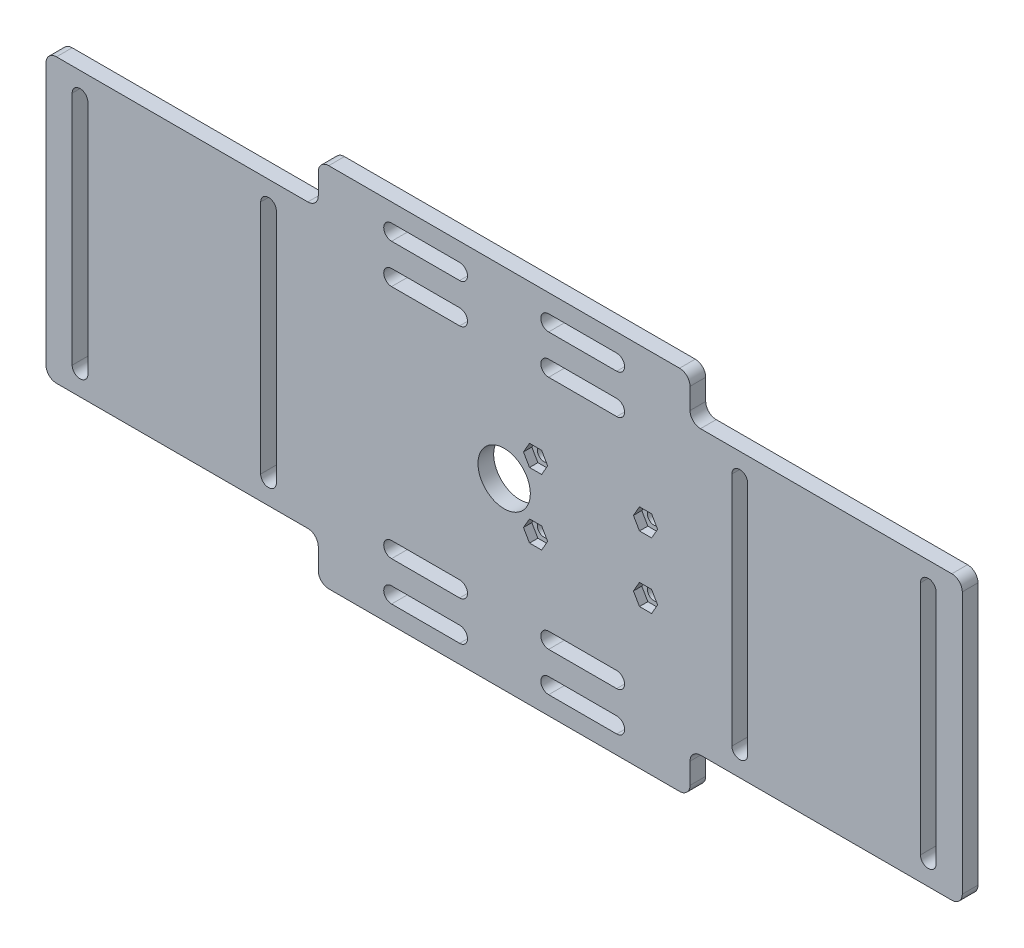
from build123d import *
from OCP.BRepFilletAPI import BRepFilletAPI_MakeChamfer
from build123d.topology import SkipClean

# Parameters (mm, degrees)
EXTRUDE_1_DEPTH     = 3
SKETCH_2_R          = 5
SKETCH_2_R_2        = 1.25
CUT_EXTRUDE_1_DEPTH = 95.288122264
CUT_EXTRUDE_2_DEPTH = 1.6
SKETCH_4_R          = 2
SKETCH_4_R_2        = 1.25
EXTRUDE_2_DEPTH     = 2
CHAMFER_1_SIZE      = 0.5
CHAMFER_1_SIZE2     = 0.288675135


with BuildPart() as part:
    # 草圖1 → 填料-伸長1 (new body)
    with BuildSketch(Plane.XY):
        with BuildLine():
            Line((35.5, 33), (35.5, 29))
            ThreePointArc((35.5, 29), (36.085786438, 27.585786438), (37.5, 27))
            Line((37.5, 27), (85.5, 27))
            ThreePointArc((85.5, 27), (86.914213562, 26.414213562), (87.5, 25))
            Line((87.5, 25), (87.5, -25))
            ThreePointArc((87.5, -25), (86.914213562, -26.414213562), (85.5, -27))
            Line((85.5, -27), (37.5, -27))
            ThreePointArc((37.5, -27), (36.085786438, -27.585786438), (35.5, -29))
            Line((35.5, -29), (35.5, -33))
            ThreePointArc((35.5, -33), (34.914213562, -34.414213562), (33.5, -35))
            Line((33.5, -35), (-33.5, -35))
            ThreePointArc((-33.5, -35), (-34.914213562, -34.414213562), (-35.5, -33))
            Line((-35.5, -33), (-35.5, -29))
            ThreePointArc((-35.5, -29), (-36.085786438, -27.585786438), (-37.5, -27))
            Line((-37.5, -27), (-85.5, -27))
            ThreePointArc((-85.5, -27), (-86.914213562, -26.414213562), (-87.5, -25))
            Line((-87.5, -25), (-87.5, 25))
            ThreePointArc((-87.5, 25), (-86.914213562, 26.414213562), (-85.5, 27))
            Line((-85.5, 27), (-37.5, 27))
            ThreePointArc((-37.5, 27), (-36.085786438, 27.585786438), (-35.5, 29))
            Line((-35.5, 29), (-35.5, 33))
            ThreePointArc((-35.5, 33), (-34.914213562, 34.414213562), (-33.5, 35))
            Line((-33.5, 35), (33.5, 35))
            ThreePointArc((33.5, 35), (34.914213562, 34.414213562), (35.5, 33))
        make_face()
    extrude(amount=EXTRUDE_1_DEPTH)

    # 草圖2 → 除料-伸長1 (cut, through all)
    with BuildSketch(Plane.XY.offset(3)):
        Circle(SKETCH_2_R)
        with Locations((27, 6.25)):
            Circle(SKETCH_2_R_2)
        with Locations((6, 6.25)):
            Circle(SKETCH_2_R_2)
        with Locations((6, -6.25)):
            Circle(SKETCH_2_R_2)
        with Locations((27, -6.25)):
            Circle(SKETCH_2_R_2)
        with BuildLine():
            Line((43.5, -22.5), (43.5, 22.5))
            ThreePointArc((43.5, 22.5), (45, 24), (46.5, 22.5))
            Line((46.5, 22.5), (46.5, -22.5))
            ThreePointArc((46.5, -22.5), (45, -24), (43.5, -22.5))
        make_face()
        with BuildLine():
            Line((-46.5, -22.5), (-46.5, 22.5))
            ThreePointArc((-46.5, 22.5), (-45, 24), (-43.5, 22.5))
            Line((-43.5, 22.5), (-43.5, -22.5))
            ThreePointArc((-43.5, -22.5), (-45, -24), (-46.5, -22.5))
        make_face()
        with BuildLine():
            Line((-82.5, -22.5), (-82.5, 22.5))
            ThreePointArc((-82.5, 22.5), (-81, 24), (-79.5, 22.5))
            Line((-79.5, 22.5), (-79.5, -22.5))
            ThreePointArc((-79.5, -22.5), (-81, -24), (-82.5, -22.5))
        make_face()
        with BuildLine():
            Line((79.5, -22.5), (79.5, 22.5))
            ThreePointArc((79.5, 22.5), (81, 24), (82.5, 22.5))
            Line((82.5, 22.5), (82.5, -22.5))
            ThreePointArc((82.5, -22.5), (81, -24), (79.5, -22.5))
        make_face()
        with BuildLine():
            Line((21.5, -31.5), (8.5, -31.5))
            ThreePointArc((8.5, -31.5), (7, -30), (8.5, -28.5))
            Line((8.5, -28.5), (21.5, -28.5))
            ThreePointArc((21.5, -28.5), (23, -30), (21.5, -31.5))
        make_face()
        with BuildLine():
            Line((-21.5, -31.5), (-8.5, -31.5))
            ThreePointArc((-8.5, -31.5), (-7, -30), (-8.5, -28.5))
            Line((-8.5, -28.5), (-21.5, -28.5))
            ThreePointArc((-21.5, -28.5), (-23, -30), (-21.5, -31.5))
        make_face()
        with BuildLine():
            Line((21.5, 31.5), (8.5, 31.5))
            ThreePointArc((8.5, 31.5), (7, 30), (8.5, 28.5))
            Line((8.5, 28.5), (21.5, 28.5))
            ThreePointArc((21.5, 28.5), (23, 30), (21.5, 31.5))
        make_face()
        with BuildLine():
            Line((-21.5, 31.5), (-8.5, 31.5))
            ThreePointArc((-8.5, 31.5), (-7, 30), (-8.5, 28.5))
            Line((-8.5, 28.5), (-21.5, 28.5))
            ThreePointArc((-21.5, 28.5), (-23, 30), (-21.5, 31.5))
        make_face()
        with BuildLine():
            Line((21.5, 24), (8.5, 24))
            ThreePointArc((8.5, 24), (7, 22.5), (8.5, 21))
            Line((8.5, 21), (21.5, 21))
            ThreePointArc((21.5, 21), (23, 22.5), (21.5, 24))
        make_face()
        with BuildLine():
            Line((-21.5, 24), (-8.5, 24))
            ThreePointArc((-8.5, 24), (-7, 22.5), (-8.5, 21))
            Line((-8.5, 21), (-21.5, 21))
            ThreePointArc((-21.5, 21), (-23, 22.5), (-21.5, 24))
        make_face()
        with BuildLine():
            Line((-21.5, -24), (-8.5, -24))
            ThreePointArc((-8.5, -24), (-7, -22.5), (-8.5, -21))
            Line((-8.5, -21), (-21.5, -21))
            ThreePointArc((-21.5, -21), (-23, -22.5), (-21.5, -24))
        make_face()
        with BuildLine():
            Line((21.5, -24), (8.5, -24))
            ThreePointArc((8.5, -24), (7, -22.5), (8.5, -21))
            Line((8.5, -21), (21.5, -21))
            ThreePointArc((21.5, -21), (23, -22.5), (21.5, -24))
        make_face()
    extrude(amount=-CUT_EXTRUDE_1_DEPTH, mode=Mode.SUBTRACT)

    # 草圖3 → 除料-伸長2 (cut)
    with BuildSketch(Plane.XY.offset(3)):
        Polygon((29.309401077, -6.25), (28.154700538, -4.25), (25.845299462, -4.25), (24.690598923, -6.25), (25.845299462, -8.25), (28.154700538, -8.25), align=None)
        Polygon((8.309401077, -6.25), (7.154700538, -4.25), (4.845299462, -4.25), (3.690598923, -6.25), (4.845299462, -8.25), (7.154700538, -8.25), align=None)
        Polygon((29.309401077, 6.25), (28.154700538, 8.25), (25.845299462, 8.25), (24.690598923, 6.25), (25.845299462, 4.25), (28.154700538, 4.25), align=None)
        Polygon((8.309401077, 6.25), (7.154700538, 8.25), (4.845299462, 8.25), (3.690598923, 6.25), (4.845299462, 4.25), (7.154700538, 4.25), align=None)
    extrude(amount=-CUT_EXTRUDE_2_DEPTH, mode=Mode.SUBTRACT)

    # 草圖4 → 填料-伸長2 (add)
    # profile 1 of 4: a face of its own
    with SkipClean():  # the faces are left unmerged after this step: merging them gives an invalid solid
        with BuildSketch(Plane(origin=(0, 0, 0), x_dir=(-1, 0, 0), z_dir=(0, 0, -1))):
            with Locations((-27, 6.25)):
                Circle(SKETCH_4_R)
            with Locations((-27, 6.25)):
                Circle(SKETCH_4_R_2, mode=Mode.SUBTRACT)
        # profile 2 of 4: a face of its own
        with BuildSketch(Plane(origin=(0, 0, 0), x_dir=(-1, 0, 0), z_dir=(0, 0, -1))):
            with Locations((-27, -6.25)):
                Circle(SKETCH_4_R)
            with Locations((-27, -6.25)):
                Circle(SKETCH_4_R_2, mode=Mode.SUBTRACT)
        # profile 3 of 4: a face of its own
        with BuildSketch(Plane(origin=(0, 0, 0), x_dir=(-1, 0, 0), z_dir=(0, 0, -1))):
            with Locations((-6, 6.25)):
                Circle(SKETCH_4_R)
            with Locations((-6, 6.25)):
                Circle(SKETCH_4_R_2, mode=Mode.SUBTRACT)
        # profile 4 of 4: a face of its own
        with BuildSketch(Plane(origin=(0, 0, 0), x_dir=(-1, 0, 0), z_dir=(0, 0, -1))):
            with Locations((-6, -6.25)):
                Circle(SKETCH_4_R)
            with Locations((-6, -6.25)):
                Circle(SKETCH_4_R_2, mode=Mode.SUBTRACT)
        extrude(amount=EXTRUDE_2_DEPTH)

    # 導角1: one chamfer whose edges measure the first distance from different faces: ONE call of the kernel's chamfer builder (chamfer() names one face for all edges)
    chamfer_1_edges_1 = [part.edges().sort_by_distance(p)[0] for p in [
        (28.25, 6.25, -2),
    ]]
    chamfer_1_side_1 = [part.faces().sort_by_distance(p)[0] for p in [
        (28.943431458, 6.25, -2),
    ]]
    chamfer_1_edges_2 = [part.edges().sort_by_distance(p)[0] for p in [
        (7.25, 6.25, -2),
    ]]
    chamfer_1_side_2 = [part.faces().sort_by_distance(p)[0] for p in [
        (7.943431458, 6.25, -2),
    ]]
    chamfer_1_edges_3 = [part.edges().sort_by_distance(p)[0] for p in [
        (7.25, -6.25, -2),
    ]]
    chamfer_1_side_3 = [part.faces().sort_by_distance(p)[0] for p in [
        (7.943431458, -6.25, -2),
    ]]
    chamfer_1_edges_4 = [part.edges().sort_by_distance(p)[0] for p in [
        (28.25, -6.25, -2),
    ]]
    chamfer_1_side_4 = [part.faces().sort_by_distance(p)[0] for p in [
        (28.943431458, -6.25, -2),
    ]]
    chamfer_1 = BRepFilletAPI_MakeChamfer(part.part.solid().wrapped)
    for e in chamfer_1_edges_1:
        chamfer_1.Add(CHAMFER_1_SIZE, CHAMFER_1_SIZE2, e.wrapped, chamfer_1_side_1[0].wrapped)  # the first distance lies on this face
    for e in chamfer_1_edges_2:
        chamfer_1.Add(CHAMFER_1_SIZE, CHAMFER_1_SIZE2, e.wrapped, chamfer_1_side_2[0].wrapped)  # the first distance lies on this face
    for e in chamfer_1_edges_3:
        chamfer_1.Add(CHAMFER_1_SIZE, CHAMFER_1_SIZE2, e.wrapped, chamfer_1_side_3[0].wrapped)  # the first distance lies on this face
    for e in chamfer_1_edges_4:
        chamfer_1.Add(CHAMFER_1_SIZE, CHAMFER_1_SIZE2, e.wrapped, chamfer_1_side_4[0].wrapped)  # the first distance lies on this face
    add(Compound.cast(chamfer_1.Shape()), mode=Mode.REPLACE)


solid = part.part
